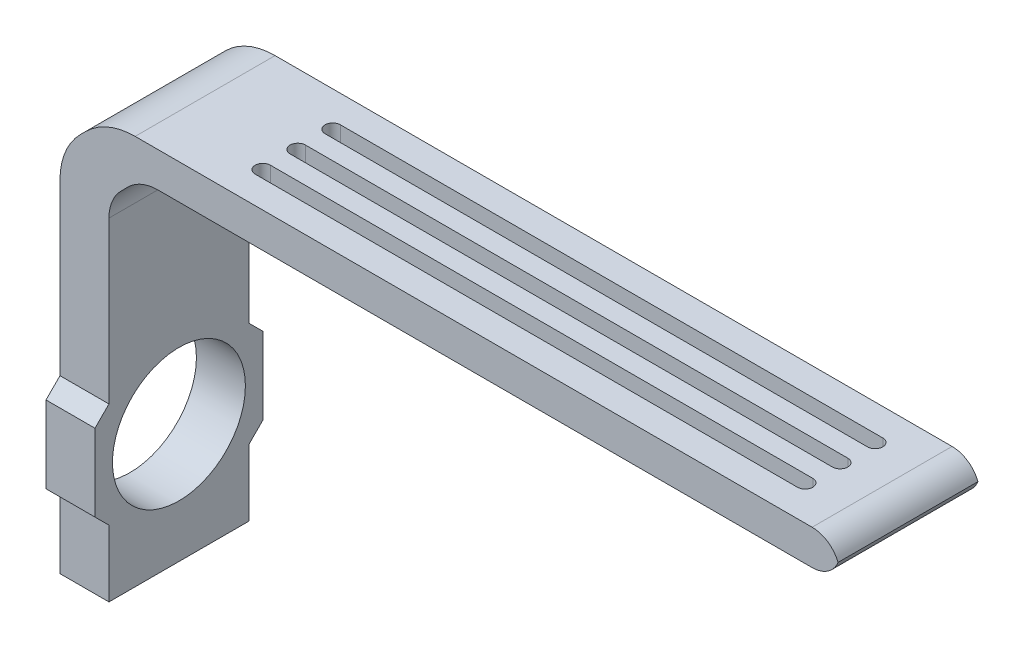
from build123d import *

# Parameters (mm, degrees)
BOSS_EXTRUDE1_DEPTH = 20
FILLET1_R           = 6
SKETCH5_W           = 7
SKETCH5_H           = 15
BOSS_EXTRUDE3_DEPTH = 2
CUT_EXTRUDE1_DEPTH  = 5
SKETCH3_R           = 9.5
CUT_EXTRUDE2_DEPTH  = 7
SKETCH6_W           = 7
SKETCH6_H           = 15
BOSS_EXTRUDE4_DEPTH = 2
FILLET3_R           = 4
FILLET2_R           = 10
CHAMFER1_SIZE       = 2


# Some blends are built 0.0001 mm under size
with BuildPart() as part:
    # Sketch1 → Boss-Extrude1 (new body)
    with BuildSketch(Plane.XY):
        Polygon((-37.553334028, 5.009990716), (-37.553334028, 0.009990716), (-137.553334028, 0.009990716), (-142.053334028, -4.490009284), (-142.053334028, -54.490009284), (-149.053334028, -54.490009284), (-149.053334028, -1.590514347), (-142.452828965, 5.009990716), align=None)
    extrude(amount=BOSS_EXTRUDE1_DEPTH)

    # Fillet1
    fillet1_edges = [part.edges().sort_by_distance(p)[0] for p in [
        (-137.553334028, 0.009990716, 10),
        (-142.053334028, -4.490009284, 10),
    ]]
    fillet(fillet1_edges, radius=FILLET1_R)

    # Sketch5 → Boss-Extrude3 (add)
    with BuildSketch(Plane.XY.offset(20)):
        with Locations((-145.553334028, -37.485290658)):
            Rectangle(SKETCH5_W, SKETCH5_H)
    extrude(amount=BOSS_EXTRUDE3_DEPTH)

    # Sketch2 → Cut-Extrude1 (cut)
    with BuildSketch(Plane(origin=(0, 0.009990716, 0), x_dir=(-1, 0, 0), z_dir=(0, -1, 0))):
        with BuildLine():
            Line((125.068052654, -11.1), (47.553334028, -11.1))
            ThreePointArc((47.553334028, -11.1), (46.453334028, -10), (47.553334028, -8.9))
            Line((47.553334028, -8.9), (125.068052654, -8.9))
            ThreePointArc((125.068052654, -8.9), (126.168052654, -10), (125.068052654, -11.1))
        make_face()
        with BuildLine():
            Line((125.068052654, -3.9), (47.553334028, -3.9))
            ThreePointArc((47.553334028, -3.9), (46.453334028, -5), (47.553334028, -6.1))
            Line((47.553334028, -6.1), (125.068052654, -6.1))
            ThreePointArc((125.068052654, -6.1), (126.168052654, -5), (125.068052654, -3.9))
        make_face()
        with BuildLine():
            Line((125.068052654, -16.1), (47.553334028, -16.1))
            ThreePointArc((47.553334028, -16.1), (46.453334028, -15), (47.553334028, -13.9))
            Line((47.553334028, -13.9), (125.068052654, -13.9))
            ThreePointArc((125.068052654, -13.9), (126.168052654, -15), (125.068052654, -16.1))
        make_face()
    extrude(amount=-CUT_EXTRUDE1_DEPTH, mode=Mode.SUBTRACT)

    # Sketch3 → Cut-Extrude2 (cut)
    with BuildSketch(Plane(origin=(-142.053334028, 0, 0), x_dir=(0, 0, -1), z_dir=(1, 0, 0))):
        with Locations((-10, -37.485290658)):
            Circle(SKETCH3_R)
    extrude(amount=-CUT_EXTRUDE2_DEPTH, mode=Mode.SUBTRACT)

    # Sketch6 → Boss-Extrude4 (add)
    with BuildSketch(Plane(origin=(0, 0, 0), x_dir=(-1, 0, 0), z_dir=(0, 0, -1))):
        with Locations((145.553334028, -37.485290658)):
            Rectangle(SKETCH6_W, SKETCH6_H)
    extrude(amount=BOSS_EXTRUDE4_DEPTH)

    # Fillet3
    # the kernel refuses this fillet: 4 mm, written as the material it takes off along each edge
    with BuildSketch(Plane(origin=(-37.553334028, 5.009990716, -10), x_dir=(0, -1, 0), z_dir=(0, 0, 1)), Plane(origin=(-37.553334028, 0.009990716, -10), x_dir=(-1, 0, 0), z_dir=(0, 0, 1))) as fillet3_piece_1:
        with BuildLine():
            CenterArc((FILLET3_R, -FILLET3_R), FILLET3_R, 90, 90)
            Line((0, -FILLET3_R), (0, 0))
            Line((0, 0), (FILLET3_R, 0))
        make_face()
    extrude(amount=40, mode=Mode.SUBTRACT)

    # Fillet2
    fillet2_edges = [part.edges().sort_by_distance(p)[0] for p in [
        (-149.053334028, -1.590514347, 10),
        (-142.452828965, 5.009990716, 10),
    ]]
    fillet(fillet2_edges, radius=FILLET2_R)

    # Chamfer1
    chamfer1_edges = [part.edges().sort_by_distance(p)[0] for p in [
        (-145.553334028, -29.985290658, 22),
        (-145.553334028, -44.985290658, 22),
        (-145.553334028, -29.985290658, -2),
        (-145.553334028, -44.985290658, -2),
    ]]
    chamfer(chamfer1_edges, length=CHAMFER1_SIZE - 0.0001)  # a hair under: the kernel refuses the full size


solid = part.part
